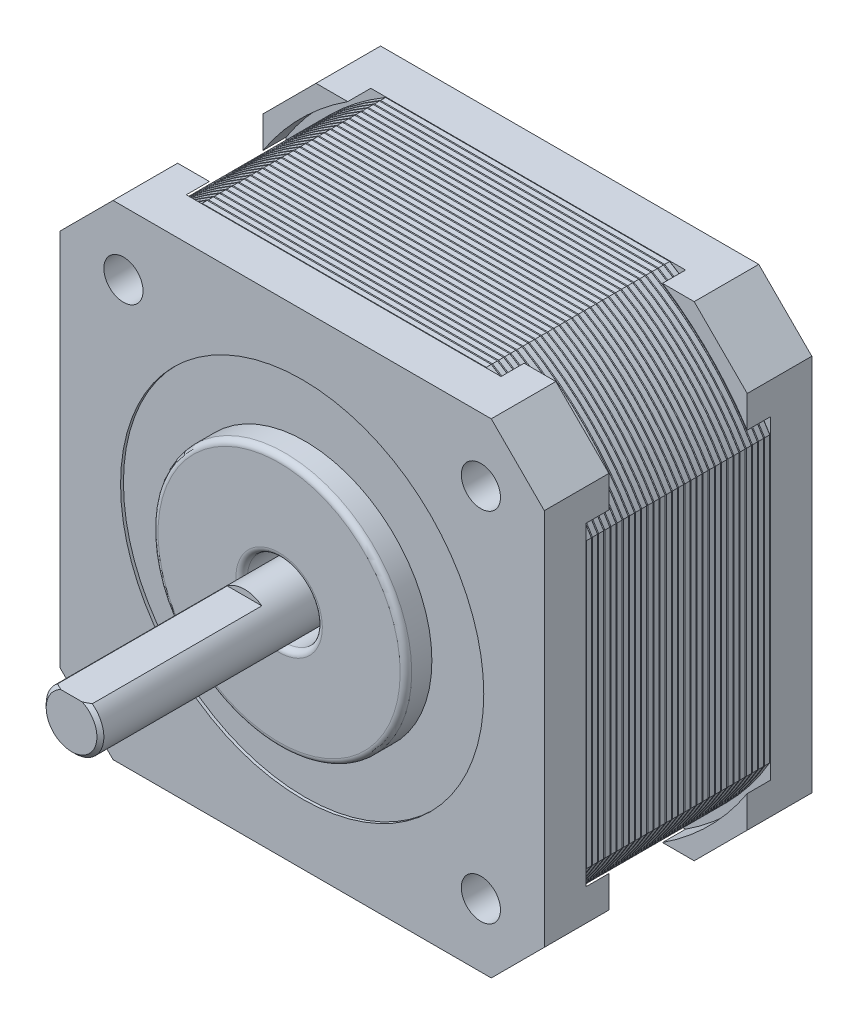
from build123d import *

# Parameters (mm, degrees)
SKETCH1_W                      = 42
SKETCH1_H                      = 42
BOSS_EXTRUDE1_DEPTH            = 23.2
CHAMFER1_SIZE                  = 4.6
SKETCH2_R                      = 11
BOSS_EXTRUDE2_DEPTH            = 2
BOSS_EXTRUDE4_START            = -2
SKETCH3_R                      = 2.5
BOSS_EXTRUDE4_DEPTH            = 20
SKETCH3_2_R                    = 2.5
CUT_EXTRUDE3_DEPTH             = 2
SKETCH4_W                      = 3
SKETCH4_H                      = 1
CUT_EXTRUDE4_DEPTH             = 15
CHAMFER2_SIZE                  = 0.3
M3X0_5_TAPPED_HOLE1_AT_2_COUNT = 2
M3X0_5_TAPPED_HOLE1_AT_2_PITCH = 31
M3X0_5_TAPPED_HOLE1_AT_3_COUNT = 2
M3X0_5_TAPPED_HOLE1_AT_3_PITCH = 43.840620434
M3X0_5_TAPPED_HOLE1_AT_4_COUNT = 2
M3X0_5_TAPPED_HOLE1_AT_4_PITCH = 31
CUT_EXTRUDE5_START             = -0.25
SKETCH2_3_R                    = 15.75
SKETCH2_3_R_2                  = 11
CUT_EXTRUDE5_DEPTH             = 0.25
SKETCH3_3_R                    = 3.25
SKETCH3_3_R_2                  = 2.5
CUT_EXTRUDE_THIN1_DEPTH        = 6
FILLET1_R                      = 0.5
CUT_EXTRUDE6_DEPTH             = 6
CUT_EXTRUDE_THIN2_DEPTH        = 8
CUT_EXTRUDE7_START             = 16
SKETCH13_R                     = 24.545793616
CUT_EXTRUDE7_DEPTH             = 16
SKETCH14_R                     = 1.7
BOSS_EXTRUDE5_DEPTH            = 0.533333333
CHAMFER3_SIZE                  = 0.05
LPATTERN1_COUNT                = 30
LPATTERN1_PITCH                = 0.533333333
SKETCH16_W                     = 8
SKETCH16_H                     = 7
CUT_EXTRUDE8_DEPTH             = 3
SKETCH17_W                     = 7.6
SKETCH17_H                     = 6.6
SKETCH17_W_2                   = 5.6
SKETCH17_H_2                   = 4.6
EXTRUDE_THIN1_DEPTH            = 3


# Read off the part's stored shape, not the designer's step: CSK for M3 Flat Head Machine Screw2
with BuildPart() as part:
    # Sketch1 → Boss-Extrude1 (new body)
    with BuildSketch(Plane.XY):
        Rectangle(SKETCH1_W, SKETCH1_H)
    extrude(amount=-BOSS_EXTRUDE1_DEPTH)

    # Chamfer1
    chamfer1_edges = [part.edges().sort_by_distance(p)[0] for p in [
        (21, -21, -11.6),
        (-21, -21, -11.6),
        (-21, 21, -11.6),
        (21, 21, -11.6),
    ]]
    chamfer(chamfer1_edges, length=CHAMFER1_SIZE)

    # Sketch2 → Boss-Extrude2 (add)
    with BuildSketch(Plane.XY):
        Circle(SKETCH2_R)
    extrude(amount=BOSS_EXTRUDE2_DEPTH)

    # Sketch3<2> → Cut-Extrude3 (cut)
    with BuildSketch(Plane.XY.offset(2)):
        with Locations(Location((0, 0, 0), (0, 0, 180))):
            Circle(SKETCH3_2_R)
    extrude(amount=-CUT_EXTRUDE3_DEPTH, mode=Mode.SUBTRACT)

    # Sketch6 → M3x0.5 Tapped Hole1 (revolve, cut)
    with BuildSketch(Plane(origin=(-15.5, 15.5, 0), x_dir=(0, -1, 0), z_dir=(1, 0, 0))):
        Polygon((0, 0), (0, 8.251075774), (1.25, 7.5), (1.25, 0.25), (1.5, 0), align=None)
    m3x0_5_tapped_hole1 = revolve(axis=Axis((-15.5, 15.5, 6.35), (0, 0, -1)), mode=Mode.SUBTRACT)

    # M3x0.5 Tapped Hole1 at 2: M3x0.5 Tapped Hole1 ×2
    with Locations(*[(i * M3X0_5_TAPPED_HOLE1_AT_2_PITCH, 0, 0) for i in range(1, M3X0_5_TAPPED_HOLE1_AT_2_COUNT)]):
        add(m3x0_5_tapped_hole1, mode=Mode.SUBTRACT)

    # M3x0.5 Tapped Hole1 at 3: M3x0.5 Tapped Hole1 ×2
    with Locations(*[Vector(0.7071067811865475, -0.7071067811865476, 0) * (i * M3X0_5_TAPPED_HOLE1_AT_3_PITCH) for i in range(1, M3X0_5_TAPPED_HOLE1_AT_3_COUNT)]):
        add(m3x0_5_tapped_hole1, mode=Mode.SUBTRACT)

    # M3x0.5 Tapped Hole1 at 4: M3x0.5 Tapped Hole1 ×2
    with Locations(*[(0, -i * M3X0_5_TAPPED_HOLE1_AT_4_PITCH, 0) for i in range(1, M3X0_5_TAPPED_HOLE1_AT_4_COUNT)]):
        add(m3x0_5_tapped_hole1, mode=Mode.SUBTRACT)

    # Sketch2<3> → Cut-Extrude5 (cut)
    with BuildSketch(Plane.XY.offset(CUT_EXTRUDE5_START)):
        Circle(SKETCH2_3_R)
        Circle(SKETCH2_3_R_2, mode=Mode.SUBTRACT)
    extrude(amount=CUT_EXTRUDE5_DEPTH, mode=Mode.SUBTRACT)

    # Sketch3<3> → Cut-Extrude-Thin1 (cut)
    with BuildSketch(Plane.XY.offset(2)):
        Circle(SKETCH3_3_R)
        Circle(SKETCH3_3_R_2, mode=Mode.SUBTRACT)
    extrude(amount=-CUT_EXTRUDE_THIN1_DEPTH, mode=Mode.SUBTRACT)

    # Fillet1
    fillet1_edges = [part.edges().sort_by_distance(p)[0] for p in [
        (-11, 0, 2),
        (-3.25, 0, 2),
    ]]
    fillet(fillet1_edges, radius=FILLET1_R)

    # Sketch7 → Cut-Extrude6 (cut, symmetric)
    with BuildSketch(Plane.XY.offset(-11.6)):
        with BuildLine():
            Line((21, -12.708107029), (21, -21))
            Line((21, -21), (12.708107029, -21))
            ThreePointArc((12.708107029, -21), (17.356497116, -17.356497116), (21, -12.708107029))
        make_face()
        with BuildLine():
            Line((12.708107029, 21), (21, 21))
            Line((21, 21), (21, 12.708107029))
            ThreePointArc((21, 12.708107029), (17.356497116, 17.356497116), (12.708107029, 21))
        make_face()
        with BuildLine():
            Line((-12.708107029, -21), (-21, -21))
            Line((-21, -21), (-21, -12.708107029))
            ThreePointArc((-21, -12.708107029), (-17.356497116, -17.356497116), (-12.708107029, -21))
        make_face()
        with BuildLine():
            Line((-21, 12.708107029), (-21, 21))
            Line((-21, 21), (-12.708107029, 21))
            ThreePointArc((-12.708107029, 21), (-17.356497116, 17.356497116), (-21, 12.708107029))
        make_face()
    extrude(amount=CUT_EXTRUDE6_DEPTH, both=True, mode=Mode.SUBTRACT)

    # Sketch8 → Cut-Extrude-Thin2 (cut, symmetric)
    with BuildSketch(Plane.XY.offset(-11.6)):
        with BuildLine():
            ThreePointArc((12.708107029, -21), (17.356497116, -17.356497116), (21, -12.708107029))
            Line((21, -12.708107029), (21.427771869, -12.9669723))
            ThreePointArc((21.427771869, -12.9669723), (17.710050506, -17.710050506), (12.9669723, -21.427771869))
            Line((12.9669723, -21.427771869), (12.708107029, -21))
        make_face()
        with BuildLine():
            ThreePointArc((-21, -12.708107029), (-17.356497116, -17.356497116), (-12.708107029, -21))
            Line((-12.708107029, -21), (-12.9669723, -21.427771869))
            ThreePointArc((-12.9669723, -21.427771869), (-17.710050506, -17.710050506), (-21.427771869, -12.9669723))
            Line((-21.427771869, -12.9669723), (-21, -12.708107029))
        make_face()
        with BuildLine():
            ThreePointArc((-12.708107029, 21), (-17.356497116, 17.356497116), (-21, 12.708107029))
            Line((-21, 12.708107029), (-21.427771869, 12.9669723))
            ThreePointArc((-21.427771869, 12.9669723), (-17.710050506, 17.710050506), (-12.9669723, 21.427771869))
            Line((-12.9669723, 21.427771869), (-12.708107029, 21))
        make_face()
        with BuildLine():
            ThreePointArc((21, 12.708107029), (17.356497116, 17.356497116), (12.708107029, 21))
            Line((12.708107029, 21), (12.9669723, 21.427771869))
            ThreePointArc((12.9669723, 21.427771869), (17.710050506, 17.710050506), (21.427771869, 12.9669723))
            Line((21.427771869, 12.9669723), (21, 12.708107029))
        make_face()
    extrude(amount=CUT_EXTRUDE_THIN2_DEPTH, both=True, mode=Mode.SUBTRACT)

    # CSK for M3 Flat Head Machine Screw2 outl → CSK for M3 Flat Head Machine Screw2 (revolve, cut)
    with BuildSketch(Plane(origin=(-15.5, -15.5, 0), x_dir=(1, 0, 0), z_dir=(0, -1, 0))):
        Polygon((1.7, 0), (1.5, 0), (1.25, -0.25), (1.25, -7.5), (0, -8.251075774), (0, -23.2), (3.15, -23.2), (1.7, -21.75), align=None)
    revolve(axis=Axis((-15.5, -15.5, 0), (0, 0, 1)), mode=Mode.SUBTRACT)

    # CSK for M3 Flat Head Machine Screw2 2 ou → CSK for M3 Flat Head Machine Screw2 2 (revolve, cut)
    with BuildSketch(Plane(origin=(15.5, -15.5, 0), x_dir=(1, 0, 0), z_dir=(0, -1, 0))):
        Polygon((1.7, 0), (1.5, 0), (1.25, -0.25), (1.25, -7.5), (0, -8.251075774), (0, -23.2), (3.15, -23.2), (1.7, -21.75), align=None)
    revolve(axis=Axis((15.5, -15.5, 0), (0, 0, 1)), mode=Mode.SUBTRACT)

    # CSK for M3 Flat Head Machine Screw2 3 ou → CSK for M3 Flat Head Machine Screw2 3 (revolve, cut)
    with BuildSketch(Plane(origin=(-15.5, 15.5, 0), x_dir=(1, 0, 0), z_dir=(0, -1, 0))):
        Polygon((1.7, 0), (1.5, 0), (1.25, -0.25), (1.25, -7.5), (0, -8.251075774), (0, -23.2), (3.15, -23.2), (1.7, -21.75), align=None)
    revolve(axis=Axis((-15.5, 15.5, 0), (0, 0, 1)), mode=Mode.SUBTRACT)

    # CSK for M3 Flat Head Machine Screw2 4 ou → CSK for M3 Flat Head Machine Screw2 4 (revolve, cut)
    with BuildSketch(Plane(origin=(15.5, 15.5, 0), x_dir=(1, 0, 0), z_dir=(0, -1, 0))):
        Polygon((1.7, 0), (1.5, 0), (1.25, -0.25), (1.25, -7.5), (0, -8.251075774), (0, -23.2), (3.15, -23.2), (1.7, -21.75), align=None)
    revolve(axis=Axis((15.5, 15.5, 0), (0, 0, 1)), mode=Mode.SUBTRACT)

    # Sketch13 → Cut-Extrude7 (cut)
    with BuildSketch(Plane.XY.offset(-19.6).offset(CUT_EXTRUDE7_START)):
        Circle(SKETCH13_R)
    extrude(amount=-CUT_EXTRUDE7_DEPTH, mode=Mode.SUBTRACT)


with BuildPart() as body_2:
    # Sketch3 → Boss-Extrude4 (new body)
    with BuildSketch(Plane.XY.offset(2).offset(BOSS_EXTRUDE4_START)):
        with Locations(Location((0, 0, 0), (0, 0, 180))):
            Circle(SKETCH3_R)
    extrude(amount=BOSS_EXTRUDE4_DEPTH)

    # Sketch4 → Cut-Extrude4 (cut)
    with BuildSketch(Plane.XY.offset(20)):
        with Locations((0, 2.5)):
            Rectangle(SKETCH4_W, SKETCH4_H)
    extrude(amount=-CUT_EXTRUDE4_DEPTH, mode=Mode.SUBTRACT)

    # Chamfer2
    chamfer2_edges = [body_2.edges().sort_by_distance(p)[0] for p in [
        (1.118033989, -2.236067977, 20),
    ]]
    chamfer(chamfer2_edges, length=CHAMFER2_SIZE)


with BuildPart() as cut_extrude7_piece_1:
    # of the separate pieces the step leaves, piece 1, a body of its own (cut_extrude7_pieces)
    add(part.part.solids().sort_by_distance((11, 0, 1.5))[0])


with BuildPart() as cut_extrude7_piece_2:
    # of the separate pieces the step leaves, piece 2, a body of its own (cut_extrude7_pieces)
    add(part.part.solids().sort_by_distance((13.648874601, -21, -19.6))[0])

    # Sketch16 → Cut-Extrude8 (cut)
    with BuildSketch(Plane.XZ.offset(21)):
        with Locations((0, -23.1)):
            Rectangle(SKETCH16_W, SKETCH16_H)
    extrude(amount=-CUT_EXTRUDE8_DEPTH, mode=Mode.SUBTRACT)


with BuildPart() as cut_extrude7_piece_3:
    # of the separate pieces the step leaves, piece 3, a body of its own (cut_extrude7_pieces)
    add(part.part.solids().sort_by_distance((2.5, 0, 0))[0])


with BuildPart() as body_5:
    # Sketch14 → Boss-Extrude5 (new body)
    with BuildSketch(Plane.XY.offset(-19.6)):
        with BuildLine():
            Line((12.317372561, 21), (-12.317372561, 21))
            ThreePointArc((-12.317372561, 21), (-17.21507576, 17.21507576), (-21, 12.317372561))
            Line((-21, 12.317372561), (-21, -12.317372561))
            ThreePointArc((-21, -12.317372561), (-17.21507576, -17.21507576), (-12.317372561, -21))
            Line((-12.317372561, -21), (12.317372561, -21))
            ThreePointArc((12.317372561, -21), (17.21507576, -17.21507576), (21, -12.317372561))
            Line((21, -12.317372561), (21, 12.317372561))
            ThreePointArc((21, 12.317372561), (17.21507576, 17.21507576), (12.317372561, 21))
        make_face()
        with Locations((15.5, 15.5)):
            Circle(SKETCH14_R, mode=Mode.SUBTRACT)
        with Locations((-15.5, 15.5)):
            Circle(SKETCH14_R, mode=Mode.SUBTRACT)
        with Locations((15.5, -15.5)):
            Circle(SKETCH14_R, mode=Mode.SUBTRACT)
        with Locations((-15.5, -15.5)):
            Circle(SKETCH14_R, mode=Mode.SUBTRACT)
    extrude(amount=BOSS_EXTRUDE5_DEPTH)

    # Chamfer3
    chamfer3_edges = [body_5.edges().sort_by_distance(p)[0] for p in [
        (-17.21507576, -17.21507576, -19.066666667),
        (-21, 0, -19.6),
        (-17.21507576, 17.21507576, -19.6),
        (0, -21, -19.066666667),
        (17.21507576, -17.21507576, -19.066666667),
        (21, 0, -19.066666667),
        (13.8, 15.5, -19.6),
        (13.8, 15.5, -19.066666667),
        (17.21507576, 17.21507576, -19.066666667),
        (-17.2, 15.5, -19.6),
        (-17.2, 15.5, -19.066666667),
        (0, 21, -19.066666667),
        (13.8, -15.5, -19.6),
        (13.8, -15.5, -19.066666667),
        (-17.2, -15.5, -19.6),
        (-17.2, -15.5, -19.066666667),
        (-17.21507576, 17.21507576, -19.066666667),
        (-21, 0, -19.066666667),
        (0, 21, -19.6),
        (17.21507576, 17.21507576, -19.6),
        (21, 0, -19.6),
        (17.21507576, -17.21507576, -19.6),
        (0, -21, -19.6),
        (-17.21507576, -17.21507576, -19.6),
    ]]
    chamfer(chamfer3_edges, length=CHAMFER3_SIZE)


with BuildPart() as lpattern1_1:
    # LPattern1: pattern copy
    add(body_5.part.moved(Location(Vector(0, 0, 1) * (1 * LPATTERN1_PITCH))))


with BuildPart() as lpattern1_2:
    # LPattern1: pattern copy
    add(body_5.part.moved(Location(Vector(0, 0, 1) * (2 * LPATTERN1_PITCH))))


with BuildPart() as lpattern1_3:
    # LPattern1: pattern copy
    add(body_5.part.moved(Location(Vector(0, 0, 1) * (3 * LPATTERN1_PITCH))))


with BuildPart() as lpattern1_4:
    # LPattern1: pattern copy
    add(body_5.part.moved(Location(Vector(0, 0, 1) * (4 * LPATTERN1_PITCH))))


with BuildPart() as lpattern1_5:
    # LPattern1: pattern copy
    add(body_5.part.moved(Location(Vector(0, 0, 1) * (5 * LPATTERN1_PITCH))))


with BuildPart() as lpattern1_6:
    # LPattern1: pattern copy
    add(body_5.part.moved(Location(Vector(0, 0, 1) * (6 * LPATTERN1_PITCH))))


with BuildPart() as lpattern1_7:
    # LPattern1: pattern copy
    add(body_5.part.moved(Location(Vector(0, 0, 1) * (7 * LPATTERN1_PITCH))))


with BuildPart() as lpattern1_8:
    # LPattern1: pattern copy
    add(body_5.part.moved(Location(Vector(0, 0, 1) * (8 * LPATTERN1_PITCH))))


with BuildPart() as lpattern1_9:
    # LPattern1: pattern copy
    add(body_5.part.moved(Location(Vector(0, 0, 1) * (9 * LPATTERN1_PITCH))))


with BuildPart() as lpattern1_10:
    # LPattern1: pattern copy
    add(body_5.part.moved(Location(Vector(0, 0, 1) * (10 * LPATTERN1_PITCH))))


with BuildPart() as lpattern1_11:
    # LPattern1: pattern copy
    add(body_5.part.moved(Location(Vector(0, 0, 1) * (11 * LPATTERN1_PITCH))))


with BuildPart() as lpattern1_12:
    # LPattern1: pattern copy
    add(body_5.part.moved(Location(Vector(0, 0, 1) * (12 * LPATTERN1_PITCH))))


with BuildPart() as lpattern1_13:
    # LPattern1: pattern copy
    add(body_5.part.moved(Location(Vector(0, 0, 1) * (13 * LPATTERN1_PITCH))))


with BuildPart() as lpattern1_14:
    # LPattern1: pattern copy
    add(body_5.part.moved(Location(Vector(0, 0, 1) * (14 * LPATTERN1_PITCH))))


with BuildPart() as lpattern1_15:
    # LPattern1: pattern copy
    add(body_5.part.moved(Location(Vector(0, 0, 1) * (15 * LPATTERN1_PITCH))))


with BuildPart() as lpattern1_16:
    # LPattern1: pattern copy
    add(body_5.part.moved(Location(Vector(0, 0, 1) * (16 * LPATTERN1_PITCH))))


with BuildPart() as lpattern1_17:
    # LPattern1: pattern copy
    add(body_5.part.moved(Location(Vector(0, 0, 1) * (17 * LPATTERN1_PITCH))))


with BuildPart() as lpattern1_18:
    # LPattern1: pattern copy
    add(body_5.part.moved(Location(Vector(0, 0, 1) * (18 * LPATTERN1_PITCH))))


with BuildPart() as lpattern1_19:
    # LPattern1: pattern copy
    add(body_5.part.moved(Location(Vector(0, 0, 1) * (19 * LPATTERN1_PITCH))))


with BuildPart() as lpattern1_20:
    # LPattern1: pattern copy
    add(body_5.part.moved(Location(Vector(0, 0, 1) * (20 * LPATTERN1_PITCH))))


with BuildPart() as lpattern1_21:
    # LPattern1: pattern copy
    add(body_5.part.moved(Location(Vector(0, 0, 1) * (21 * LPATTERN1_PITCH))))


with BuildPart() as lpattern1_22:
    # LPattern1: pattern copy
    add(body_5.part.moved(Location(Vector(0, 0, 1) * (22 * LPATTERN1_PITCH))))


with BuildPart() as lpattern1_23:
    # LPattern1: pattern copy
    add(body_5.part.moved(Location(Vector(0, 0, 1) * (23 * LPATTERN1_PITCH))))


with BuildPart() as lpattern1_24:
    # LPattern1: pattern copy
    add(body_5.part.moved(Location(Vector(0, 0, 1) * (24 * LPATTERN1_PITCH))))


with BuildPart() as lpattern1_25:
    # LPattern1: pattern copy
    add(body_5.part.moved(Location(Vector(0, 0, 1) * (25 * LPATTERN1_PITCH))))


with BuildPart() as lpattern1_26:
    # LPattern1: pattern copy
    add(body_5.part.moved(Location(Vector(0, 0, 1) * (26 * LPATTERN1_PITCH))))


with BuildPart() as lpattern1_27:
    # LPattern1: pattern copy
    add(body_5.part.moved(Location(Vector(0, 0, 1) * (27 * LPATTERN1_PITCH))))


with BuildPart() as lpattern1_28:
    # LPattern1: pattern copy
    add(body_5.part.moved(Location(Vector(0, 0, 1) * (28 * LPATTERN1_PITCH))))


with BuildPart() as lpattern1_29:
    # LPattern1: pattern copy
    add(body_5.part.moved(Location(Vector(0, 0, 1) * (29 * LPATTERN1_PITCH))))


with BuildPart() as body_35:
    # Sketch17 → Extrude-Thin1 (new body)
    with BuildSketch(Plane.XZ.offset(18)):
        with Locations((0, -23.1)):
            Rectangle(SKETCH17_W, SKETCH17_H)
        with Locations((0, -23.1)):
            Rectangle(SKETCH17_W_2, SKETCH17_H_2, mode=Mode.SUBTRACT)
    extrude(amount=EXTRUDE_THIN1_DEPTH)


solid = Compound([body_2.part, cut_extrude7_piece_1.part, cut_extrude7_piece_2.part, cut_extrude7_piece_3.part, body_5.part, lpattern1_1.part, lpattern1_2.part, lpattern1_3.part, lpattern1_4.part, lpattern1_5.part, lpattern1_6.part, lpattern1_7.part, lpattern1_8.part, lpattern1_9.part, lpattern1_10.part, lpattern1_11.part, lpattern1_12.part, lpattern1_13.part, lpattern1_14.part, lpattern1_15.part, lpattern1_16.part, lpattern1_17.part, lpattern1_18.part, lpattern1_19.part, lpattern1_20.part, lpattern1_21.part, lpattern1_22.part, lpattern1_23.part, lpattern1_24.part, lpattern1_25.part, lpattern1_26.part, lpattern1_27.part, lpattern1_28.part, lpattern1_29.part, body_35.part])
